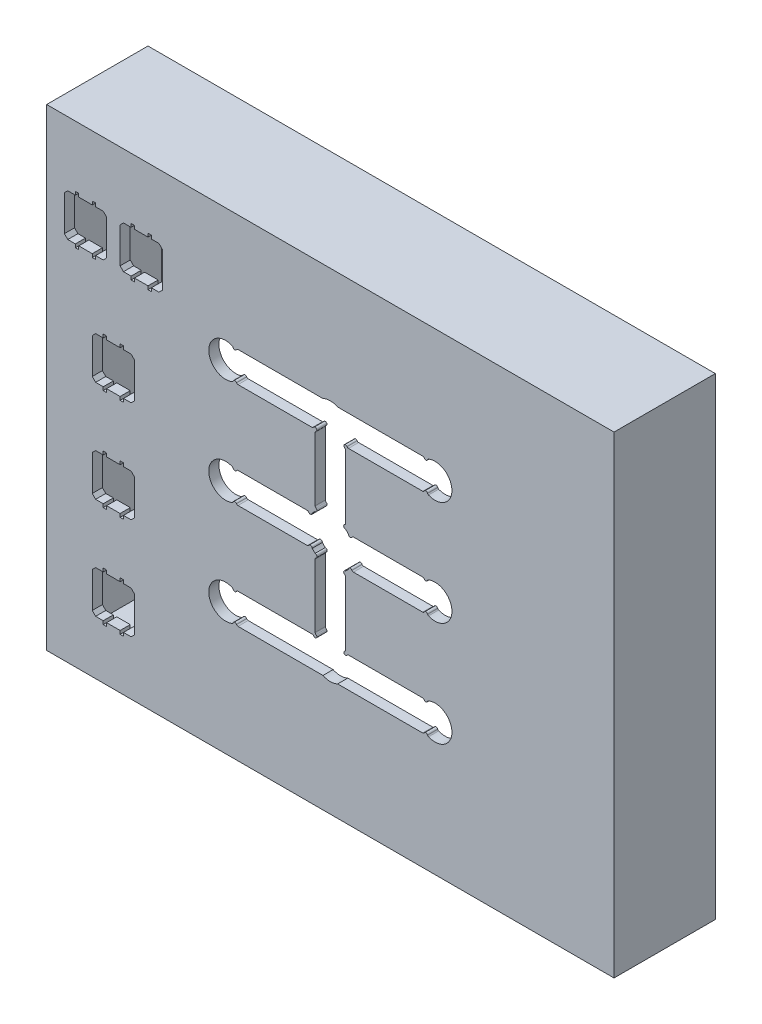
from build123d import *

# Parameters (mm, degrees)
SKETCH_1_W           = 168
SKETCH_1_H           = 140
EXTRUDE_1_DEPTH      = 3
SKETCH_3_W           = 168
SKETCH_3_H           = 140
SKETCH_3_W_2         = 160
SKETCH_3_H_2         = 132
EXTRUDE_3_DEPTH      = 27
SKETCH_11_W          = 12.5
SKETCH_11_H          = 12.5
SKETCH_11_W_2        = 1
SKETCH_11_H_2        = 1
CUT_EXTRUDE_3_DEPTH  = 27
SKETCH_19_W          = 90
SKETCH_19_H          = 2
CUT_EXTRUDE_6_DEPTH  = 1
SKETCH_20_W          = 90
SKETCH_20_H          = 2
CUT_EXTRUDE_7_DEPTH  = 1
CUT_EXTRUDE_10_DEPTH = 10
SKETCH_24_R          = 0.55
SKETCH_24_R_2        = 0.5
EXTRUDE_2_DEPTH      = 3
FILLET_1_R           = 0.5
FILLET_2_DEPTH       = 3
CHAMFER_1_SIZE       = 1


with BuildPart() as part:
    # 스케치1 → 보스-돌출1 (new body)
    with BuildSketch(Plane.XY):
        Rectangle(SKETCH_1_W, SKETCH_1_H)
    extrude(amount=EXTRUDE_1_DEPTH)

    # 스케치3 → 돌출-얇게3 (add)
    with BuildSketch(Plane(origin=(0, 0, 0), x_dir=(-1, 0, 0), z_dir=(0, 0, -1))):
        Rectangle(SKETCH_3_W, SKETCH_3_H)
        Rectangle(SKETCH_3_W_2, SKETCH_3_H_2, mode=Mode.SUBTRACT)
    extrude(amount=EXTRUDE_3_DEPTH)

    # 스케치11 → 컷-돌출3 (cut)
    with BuildSketch(Plane.XY.offset(3)):
        with Locations((-64.25, -47.75)):
            Rectangle(SKETCH_11_W, SKETCH_11_H)
        with Locations((-66.75, -54.5)):
            Rectangle(SKETCH_11_W_2, SKETCH_11_H_2)
        with Locations((-61.75, -54.5)):
            Rectangle(SKETCH_11_W_2, SKETCH_11_H_2)
        with Locations((-64.25, -17.75)):
            Rectangle(SKETCH_11_W, SKETCH_11_H)
        with Locations((-61.75, -24.5)):
            Rectangle(SKETCH_11_W_2, SKETCH_11_H_2)
        with Locations((-66.75, -24.5)):
            Rectangle(SKETCH_11_W_2, SKETCH_11_H_2)
        with Locations((-66.75, -11)):
            Rectangle(SKETCH_11_W_2, SKETCH_11_H_2)
        with Locations((-61.75, -11)):
            Rectangle(SKETCH_11_W_2, SKETCH_11_H_2)
        with Locations((-64.25, 12.25)):
            Rectangle(SKETCH_11_W, SKETCH_11_H)
        with Locations((-61.75, 19)):
            Rectangle(SKETCH_11_W_2, SKETCH_11_H_2)
        with Locations((-66.75, 19)):
            Rectangle(SKETCH_11_W_2, SKETCH_11_H_2)
        with Locations((-66.75, 5.5)):
            Rectangle(SKETCH_11_W_2, SKETCH_11_H_2)
        with Locations((-61.75, 5.5)):
            Rectangle(SKETCH_11_W_2, SKETCH_11_H_2)
        with Locations((-56, 44.75)):
            Rectangle(SKETCH_11_W, SKETCH_11_H)
        with Locations((-58.5, 38)):
            Rectangle(SKETCH_11_W_2, SKETCH_11_H_2)
        with Locations((-53.5, 51.5)):
            Rectangle(SKETCH_11_W_2, SKETCH_11_H_2)
        with Locations((-58.5, 51.5)):
            Rectangle(SKETCH_11_W_2, SKETCH_11_H_2)
        with Locations((-72.5, 44.75)):
            Rectangle(SKETCH_11_W, SKETCH_11_H)
        with Locations((-75, 38)):
            Rectangle(SKETCH_11_W_2, SKETCH_11_H_2)
        with Locations((-70, 38)):
            Rectangle(SKETCH_11_W_2, SKETCH_11_H_2)
        with Locations((-70, 51.5)):
            Rectangle(SKETCH_11_W_2, SKETCH_11_H_2)
        with Locations((-75, 51.5)):
            Rectangle(SKETCH_11_W_2, SKETCH_11_H_2)
        with Locations((-66.75, -41)):
            Rectangle(SKETCH_11_W_2, SKETCH_11_H_2)
        with Locations((-61.75, -41)):
            Rectangle(SKETCH_11_W_2, SKETCH_11_H_2)
        with Locations((-53.5, 38)):
            Rectangle(SKETCH_11_W_2, SKETCH_11_H_2)
    extrude(amount=-CUT_EXTRUDE_3_DEPTH, mode=Mode.SUBTRACT)

    # 스케치19 → 컷-돌출6 (cut)
    with BuildSketch(Plane.XZ.offset(-66)):
        with Locations((0, -24.5)):
            Rectangle(SKETCH_19_W, SKETCH_19_H)
    extrude(amount=-CUT_EXTRUDE_6_DEPTH, mode=Mode.SUBTRACT)

    # 스케치20 → 컷-돌출7 (cut)
    with BuildSketch(Plane(origin=(0, -66, 0), x_dir=(1, 0, 0), z_dir=(0, 1, 0))):
        with Locations((0, 24.5)):
            Rectangle(SKETCH_20_W, SKETCH_20_H)
    extrude(amount=-CUT_EXTRUDE_7_DEPTH, mode=Mode.SUBTRACT)

    # 스케치22 → 컷-돌출10 (cut)
    with BuildSketch(Plane.XY.offset(3)):
        with BuildLine():
            Line((4.5, 5.361902647), (4.5, 26.5))
            Line((4.5, 26.5), (28.820550528, 26.5))
            ThreePointArc((28.820550528, 26.5), (36, 31), (28.820550528, 35.5))
            Line((28.820550528, 35.5), (2.179449472, 35.5))
            ThreePointArc((2.179449472, 35.5), (0, 36), (-2.179449472, 35.5))
            Line((-2.179449472, 35.5), (-28.820550528, 35.5))
            ThreePointArc((-28.820550528, 35.5), (-36, 31), (-28.820550528, 26.5))
            Line((-28.820550528, 26.5), (-4.5, 26.5))
            Line((-4.5, 26.5), (-4.5, 5.361902647))
            ThreePointArc((-4.5, 5.361902647), (-4.949747468, 4.949747468), (-5.361902647, 4.5))
            Line((-5.361902647, 4.5), (-28.820550528, 4.5))
            ThreePointArc((-28.820550528, 4.5), (-36, 0), (-28.820550528, -4.5))
            Line((-28.820550528, -4.5), (-5.361902647, -4.5))
            ThreePointArc((-5.361902647, -4.5), (-4.949747468, -4.949747468), (-4.5, -5.361902647))
            Line((-4.5, -5.361902647), (-4.5, -26.5))
            Line((-4.5, -26.5), (-28.820550528, -26.5))
            ThreePointArc((-28.820550528, -26.5), (-36, -31), (-28.820550528, -35.5))
            Line((-28.820550528, -35.5), (-2.179449472, -35.5))
            ThreePointArc((-2.179449472, -35.5), (0, -36), (2.179449472, -35.5))
            Line((2.179449472, -35.5), (28.820550528, -35.5))
            ThreePointArc((28.820550528, -35.5), (36, -31), (28.820550528, -26.5))
            Line((28.820550528, -26.5), (4.5, -26.5))
            Line((4.5, -26.5), (4.5, -5.361902647))
            ThreePointArc((4.5, -5.361902647), (4.949747468, -4.949747468), (5.361902647, -4.5))
            Line((5.361902647, -4.5), (28.820550528, -4.5))
            ThreePointArc((28.820550528, -4.5), (36, 0), (28.820550528, 4.5))
            Line((28.820550528, 4.5), (5.361902647, 4.5))
            ThreePointArc((5.361902647, 4.5), (4.949747468, 4.949747468), (4.5, 5.361902647))
        make_face()
    extrude(amount=-CUT_EXTRUDE_10_DEPTH, mode=Mode.SUBTRACT)

    # 스케치24 → 보스-돌출2 (add)
    with BuildSketch(Plane(origin=(0, 0, 0), x_dir=(-1, 0, 0), z_dir=(0, 0, -1))):
        with Locations((28.270550528, 35.5)):
            Circle(SKETCH_24_R)
        with Locations((28.270550528, 26.5)):
            Circle(SKETCH_24_R)
        with Locations((-28.270550528, 35.5)):
            Circle(SKETCH_24_R)
        with Locations((-28.270550528, 26.5)):
            Circle(SKETCH_24_R)
        with Locations((28.270550528, 4.5)):
            Circle(SKETCH_24_R)
        with Locations((28.270550528, -4.5)):
            Circle(SKETCH_24_R)
        with Locations((-28.270550528, 4.5)):
            Circle(SKETCH_24_R)
        with Locations((-28.270550528, -4.5)):
            Circle(SKETCH_24_R)
        with Locations((-28.270550528, -26.5)):
            Circle(SKETCH_24_R)
        with Locations((-28.270550528, -35.5)):
            Circle(SKETCH_24_R)
        with Locations((28.270550528, -26.5)):
            Circle(SKETCH_24_R)
        with Locations((28.270550528, -35.5)):
            Circle(SKETCH_24_R)
        with Locations((5.911902647, 4.5)):
            Circle(SKETCH_24_R)
        with Locations((5.911902647, -4.5)):
            Circle(SKETCH_24_R)
        with Locations((4.5, -5.911902647)):
            Circle(SKETCH_24_R)
        with Locations((-4.5, -5.911902647)):
            Circle(SKETCH_24_R)
        with Locations((-5.911902647, -4.5)):
            Circle(SKETCH_24_R)
        with Locations((-5.911902647, 4.5)):
            Circle(SKETCH_24_R)
        with Locations((4.5, 5.911902647)):
            Circle(SKETCH_24_R)
        with Locations((-4.5, 5.911902647)):
            Circle(SKETCH_24_R)
        with Locations((-4.5, -26.5)):
            Circle(SKETCH_24_R_2)
        with Locations((4.5, -26.5)):
            Circle(SKETCH_24_R_2)
        with Locations((4.5, 26.5)):
            Circle(SKETCH_24_R_2)
        with Locations((-4.5, 26.5)):
            Circle(SKETCH_24_R_2)
    extrude(amount=-EXTRUDE_2_DEPTH)

    # 필렛1
    fillet_1_edges = [part.edges().sort_by_distance(p)[0] for p in [
        (-27.720550528, 35.5, 1.5),
        (-27.720550528, 26.5, 1.5),
        (27.720550528, 35.5, 1.5),
        (27.720550528, 26.5, 1.5),
        (-27.720550528, 4.5, 1.5),
        (-27.720550528, -4.5, 1.5),
        (27.720550528, 4.5, 1.5),
        (27.720550528, -4.5, 1.5),
        (27.720550528, -26.5, 1.5),
        (27.720550528, -35.5, 1.5),
        (-27.720550528, -26.5, 1.5),
        (-27.720550528, -35.5, 1.5),
        (-6.461902647, 4.5, 1.5),
        (-6.461902647, -4.5, 1.5),
        (-4.5, -6.461902647, 1.5),
        (4.5, -6.461902647, 1.5),
        (6.461902647, -4.5, 1.5),
        (6.461902647, 4.5, 1.5),
        (-4.5, 6.461902647, 1.5),
        (4.5, 6.461902647, 1.5),
        (4.5, -26, 1.5),
        (5, -26.5, 1.5),
        (-4.5, -26, 1.5),
        (-5, -26.5, 1.5),
        (-5, 26.5, 1.5),
        (-4.5, 26, 1.5),
        (4.5, 26, 1.5),
        (5, 26.5, 1.5),
    ]]
    fillet(fillet_1_edges, radius=FILLET_1_R)

    # 필렛2: read off the stored shape, not the designer's step
    # 필렛2 outline → 필렛2 (add)
    with BuildSketch(Plane.XY):
        with BuildLine():
            ThreePointArc((28.789138435, 4.316788148), (28.897050663, 4.493517479), (29.067313319, 4.611368798))
            ThreePointArc((29.067313319, 4.611368798), (28.943178013, 4.557354859), (28.820550528, 4.5))
            ThreePointArc((28.820550528, 4.5), (28.812640626, 4.407057407), (28.789138435, 4.316788148))
        make_face()
        with BuildLine():
            ThreePointArc((29.067313319, -4.611368798), (28.897050663, -4.493517479), (28.789138435, -4.316788148))
            ThreePointArc((28.789138435, -4.316788148), (28.812640626, -4.407057407), (28.820550528, -4.5))
            ThreePointArc((28.820550528, -4.5), (28.943178013, -4.557354859), (29.067313319, -4.611368798))
        make_face()
        with BuildLine():
            ThreePointArc((28.789138435, -26.683211852), (28.897050663, -26.506482521), (29.067313319, -26.388631202))
            ThreePointArc((29.067313319, -26.388631202), (28.943178013, -26.442645141), (28.820550528, -26.5))
            ThreePointArc((28.820550528, -26.5), (28.812640626, -26.592942593), (28.789138435, -26.683211852))
        make_face()
        with BuildLine():
            ThreePointArc((29.067313319, -35.611368798), (28.897050663, -35.493517479), (28.789138435, -35.316788148))
            ThreePointArc((28.789138435, -35.316788148), (28.812640626, -35.407057407), (28.820550528, -35.5))
            ThreePointArc((28.820550528, -35.5), (28.943178013, -35.557354859), (29.067313319, -35.611368798))
        make_face()
        with BuildLine():
            ThreePointArc((-28.820550528, -26.5), (-28.943178013, -26.442645141), (-29.067313319, -26.388631202))
            ThreePointArc((-29.067313319, -26.388631202), (-28.897050663, -26.506482521), (-28.789138435, -26.683211852))
            ThreePointArc((-28.789138435, -26.683211852), (-28.812640626, -26.592942593), (-28.820550528, -26.5))
        make_face()
        with BuildLine():
            ThreePointArc((-28.789138435, -35.316788148), (-28.897050663, -35.493517479), (-29.067313319, -35.611368798))
            ThreePointArc((-29.067313319, -35.611368798), (-28.943178013, -35.557354859), (-28.820550528, -35.5))
            ThreePointArc((-28.820550528, -35.5), (-28.812640626, -35.407057407), (-28.789138435, -35.316788148))
        make_face()
        with BuildLine():
            ThreePointArc((-28.820550528, -4.5), (-28.812640626, -4.407057407), (-28.789138435, -4.316788148))
            ThreePointArc((-28.789138435, -4.316788148), (-28.897050663, -4.493517479), (-29.067313319, -4.611368798))
            ThreePointArc((-29.067313319, -4.611368798), (-28.943178013, -4.557354859), (-28.820550528, -4.5))
        make_face()
        with BuildLine():
            ThreePointArc((-28.820550528, 4.5), (-28.943178013, 4.557354859), (-29.067313319, 4.611368798))
            ThreePointArc((-29.067313319, 4.611368798), (-28.897050663, 4.493517479), (-28.789138435, 4.316788148))
            ThreePointArc((-28.789138435, 4.316788148), (-28.812640626, 4.407057407), (-28.820550528, 4.5))
        make_face()
        with BuildLine():
            ThreePointArc((28.820550528, 35.5), (28.812640626, 35.407057407), (28.789138435, 35.316788148))
            ThreePointArc((28.789138435, 35.316788148), (28.897050663, 35.493517479), (29.067313319, 35.611368798))
            ThreePointArc((29.067313319, 35.611368798), (28.943178013, 35.557354859), (28.820550528, 35.5))
        make_face()
        with BuildLine():
            ThreePointArc((28.820550528, 26.5), (28.943178013, 26.442645141), (29.067313319, 26.388631202))
            ThreePointArc((29.067313319, 26.388631202), (28.897050663, 26.506482521), (28.789138435, 26.683211852))
            ThreePointArc((28.789138435, 26.683211852), (28.812640626, 26.592942593), (28.820550528, 26.5))
        make_face()
        with BuildLine():
            ThreePointArc((-28.820550528, 26.5), (-28.812640626, 26.592942593), (-28.789138435, 26.683211852))
            ThreePointArc((-28.789138435, 26.683211852), (-28.897050663, 26.506482521), (-29.067313319, 26.388631202))
            ThreePointArc((-29.067313319, 26.388631202), (-28.943178013, 26.442645141), (-28.820550528, 26.5))
        make_face()
        with BuildLine():
            ThreePointArc((-28.820550528, 35.5), (-28.943178013, 35.557354859), (-29.067313319, 35.611368798))
            ThreePointArc((-29.067313319, 35.611368798), (-28.897050663, 35.493517479), (-28.789138435, 35.316788148))
            ThreePointArc((-28.789138435, 35.316788148), (-28.812640626, 35.407057407), (-28.820550528, 35.5))
        make_face()
    extrude(amount=FILLET_2_DEPTH)

    # 모따기1
    chamfer_1_edges = [part.edges().sort_by_distance(p)[0] for p in [
        (-58, -54, 1.5),
        (-70.5, -54, 1.5),
        (-58, -41.5, 1.5),
        (-70.5, -41.5, 1.5),
        (-70.5, -24, 1.5),
        (-70.5, -11.5, 1.5),
        (-58, -11.5, 1.5),
        (-58, -24, 1.5),
        (-70.5, 6, 1.5),
        (-70.5, 18.5, 1.5),
        (-58, 18.5, 1.5),
        (-58, 6, 1.5),
        (-78.75, 38.5, 1.5),
        (-78.75, 51, 1.5),
        (-66.25, 51, 1.5),
        (-66.25, 38.5, 1.5),
        (-62.25, 38.5, 1.5),
        (-62.25, 51, 1.5),
        (-49.75, 51, 1.5),
        (-49.75, 38.5, 1.5),
    ]]
    chamfer(chamfer_1_edges, length=CHAMFER_1_SIZE)


solid = part.part
